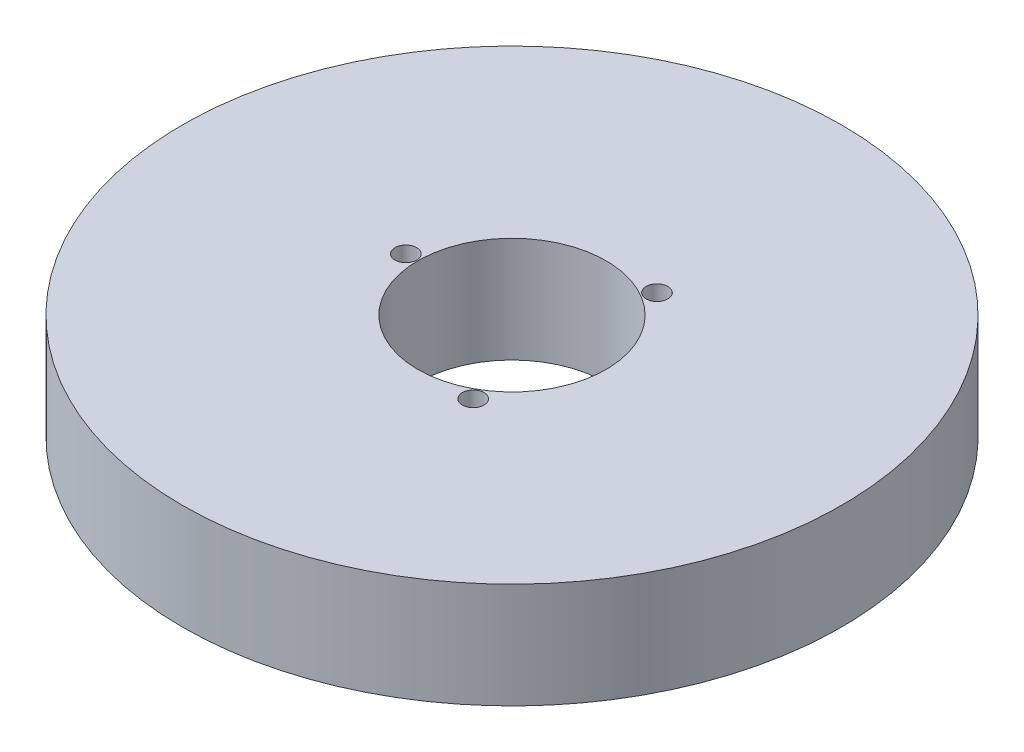
from build123d import *

# Parameters (mm, degrees)
SKETCH1_R           = 87.5
BOSS_EXTRUDE1_DEPTH = 28
SKETCH2_R           = 25
CUT_EXTRUDE1_DEPTH  = 127.871982723
SKETCH3_R           = 2.879531971
CUT_EXTRUDE2_DEPTH  = 25.352178009
CIRPATTERN1_COUNT   = 3


with BuildPart() as part:
    # Sketch1 → Boss-Extrude1 (new body)
    with BuildSketch(Plane(origin=(0, 0, 0), x_dir=(1, 0, 0), z_dir=(0, 1, 0))):
        Circle(SKETCH1_R)
    extrude(amount=BOSS_EXTRUDE1_DEPTH)

    # Sketch2 → Cut-Extrude1 (cut, through all)
    with BuildSketch(Plane(origin=(0, 0, 0), x_dir=(1, 0, 0), z_dir=(0, 1, 0))):
        Circle(SKETCH2_R)
    extrude(amount=CUT_EXTRUDE1_DEPTH, mode=Mode.SUBTRACT)

    # Sketch3 → Cut-Extrude2 (cut)
    with BuildSketch(Plane(origin=(0, 28, 0), x_dir=(1, 0, 0), z_dir=(0, 1, 0))):
        with Locations((-28.178449692, 0)):
            Circle(SKETCH3_R)
    cut_extrude2 = extrude(amount=-CUT_EXTRUDE2_DEPTH, mode=Mode.SUBTRACT)

    # CirPattern1: Cut-Extrude2 ×3 about axis
    cirpattern1_axis = Axis((0, 0, 0), (0, 1, 0))
    for i in range(1, CIRPATTERN1_COUNT):
        add(cut_extrude2.rotate(cirpattern1_axis, i * 360 / CIRPATTERN1_COUNT), mode=Mode.SUBTRACT)


solid = part.part
